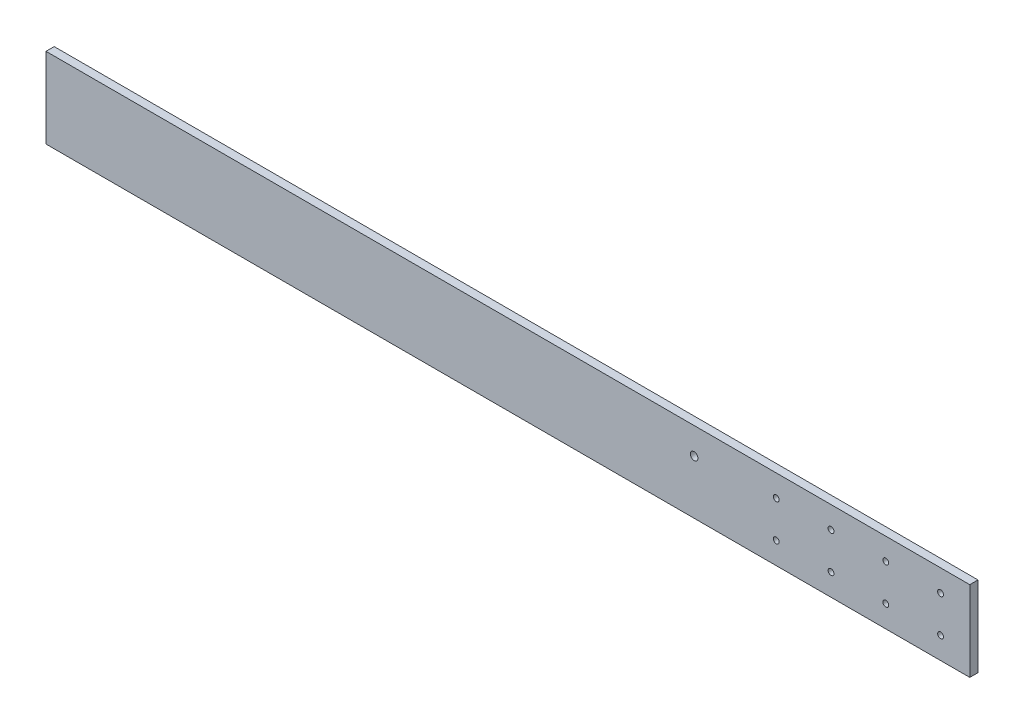
from build123d import *

# Parameters (mm, degrees)
SKETCH2_W           = 506
SKETCH2_H           = 44
SKETCH2_R           = 2.1
SKETCH2_R_2         = 1.6
BOSS_EXTRUDE1_DEPTH = 4.5


with BuildPart() as part:
    # Sketch2 → Boss-Extrude1 (new body)
    with BuildSketch(Plane.XY):
        Rectangle(SKETCH2_W, SKETCH2_H)
        with Locations((102, 7.5)):
            Circle(SKETCH2_R, mode=Mode.SUBTRACT)
        with Locations((237, 10)):
            Circle(SKETCH2_R_2, mode=Mode.SUBTRACT)
        with Locations((207, 10)):
            Circle(SKETCH2_R_2, mode=Mode.SUBTRACT)
        with Locations((177, 10)):
            Circle(SKETCH2_R_2, mode=Mode.SUBTRACT)
        with Locations((147, 10)):
            Circle(SKETCH2_R_2, mode=Mode.SUBTRACT)
        with Locations((207, -10)):
            Circle(SKETCH2_R_2, mode=Mode.SUBTRACT)
        with Locations((177, -10)):
            Circle(SKETCH2_R_2, mode=Mode.SUBTRACT)
        with Locations((147, -10)):
            Circle(SKETCH2_R_2, mode=Mode.SUBTRACT)
        with Locations((237, -10)):
            Circle(SKETCH2_R_2, mode=Mode.SUBTRACT)
    extrude(amount=BOSS_EXTRUDE1_DEPTH)


solid = part.part
